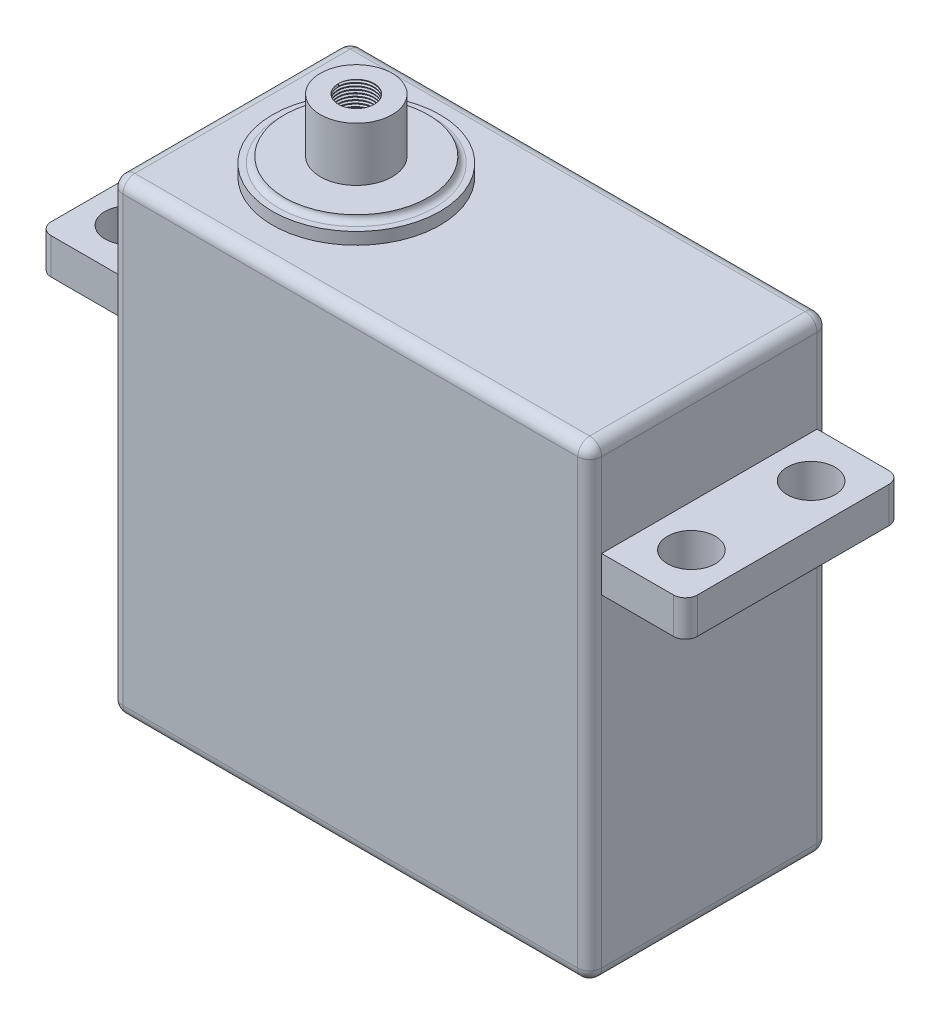
from build123d import *

# Parameters (mm, degrees)
SKETCH_1_W          = 40
SKETCH_1_H          = 39
EXTRUDE_1_DEPTH     = 20
FILLET_1_R          = 1
SKETCH_2_W          = 18
SKETCH_2_H          = 3
EXTRUDE_2_DEPTH     = 7
SKETCH_3_W          = 18
SKETCH_3_H          = 3
EXTRUDE_3_DEPTH     = 7
FILLET_8_R          = 1
FILLET_9_R          = 1
SKETCH_4_R          = 2
CUT_EXTRUDE_1_DEPTH = 7
SKETCH_5_R          = 2
CUT_EXTRUDE_2_DEPTH = 7
SKETCH_6_R          = 2
CUT_EXTRUDE_3_DEPTH = 7
SKETCH_8_R          = 2
CUT_EXTRUDE_4_DEPTH = 7
SKETCH_9_R          = 3
EXTRUDE_4_DEPTH     = 6
SKETCH_10_R         = 7
EXTRUDE_5_DEPTH     = 1
SKETCH_11_R         = 6
EXTRUDE_6_DEPTH     = 2
FILLET_11_R         = 0.5
SKETCH_12_W         = 12
SKETCH_12_H         = 0.5
CUT_EXTRUDE_6_DEPTH = 19
SKETCH_13_R         = 3
EXTRUDE_7_DEPTH     = 6
SKETCH_14_R         = 1.5
CUT_EXTRUDE_7_DEPTH = 6
THREAD_1_PITCH      = 0.25


with BuildPart() as part:
    # Sketch 1 → 凸台-拉伸1 (new body)
    with BuildSketch(Plane.XY):
        with Locations((1.208791209, 10.42505216)):
            Rectangle(SKETCH_1_W, SKETCH_1_H)
    extrude(amount=EXTRUDE_1_DEPTH)

    # 圆角1
    fillet_1_edges = [part.edges().sort_by_distance(p)[0] for p in [
        (21.208791209, 10.42505216, 20),
        (1.208791209, 29.92505216, 20),
        (-18.791208791, 10.42505216, 20),
        (1.208791209, 29.92505216, 0),
        (21.208791209, 10.42505216, 0),
        (1.208791209, -9.07494784, 0),
        (-18.791208791, 10.42505216, 0),
        (-18.791208791, 29.92505216, 10),
        (21.208791209, 29.92505216, 10),
        (21.208791209, -9.07494784, 10),
        (-18.791208791, -9.07494784, 10),
        (1.208791209, -9.07494784, 20),
    ]]
    fillet(fillet_1_edges, radius=FILLET_1_R)

    # 草图2 → 凸台-拉伸2 (add)
    with BuildSketch(Plane.ZY.offset(18.791208791)):
        with Locations((10, 20.42505216)):
            Rectangle(SKETCH_2_W, SKETCH_2_H)
    extrude(amount=EXTRUDE_2_DEPTH)

    # 草图3 → 凸台-拉伸3 (add)
    with BuildSketch(Plane(origin=(21.208791209, 0, 0), x_dir=(0, 0, -1), z_dir=(1, 0, 0))):
        with Locations((-10, 20.42505216)):
            Rectangle(SKETCH_3_W, SKETCH_3_H)
    extrude(amount=EXTRUDE_3_DEPTH)

    # 圆角8
    fillet_8_edges = [part.edges().sort_by_distance(p)[0] for p in [
        (28.208791209, 20.42505216, 1),
    ]]
    fillet(fillet_8_edges, radius=FILLET_8_R)

    # 圆角9
    fillet_9_edges = [part.edges().sort_by_distance(p)[0] for p in [
        (-25.791208791, 20.42505216, 19),
        (-25.791208791, 20.42505216, 1),
        (28.208791209, 20.42505216, 19),
    ]]
    fillet(fillet_9_edges, radius=FILLET_9_R)

    # 草图4 → 切除-拉伸1 (cut)
    with BuildSketch(Plane(origin=(0, 21.92505216, 0), x_dir=(1, 0, 0), z_dir=(0, 1, 0))):
        with Locations(Location((-22.291208791, -5, 0), (0, 0, 180))):
            Circle(SKETCH_4_R)
    extrude(amount=-CUT_EXTRUDE_1_DEPTH, mode=Mode.SUBTRACT)

    # 草图5 → 切除-拉伸2 (cut)
    with BuildSketch(Plane(origin=(0, 21.92505216, 0), x_dir=(1, 0, 0), z_dir=(0, 1, 0))):
        with Locations(Location((-22.291208791, -15, 0), (0, 0, 180))):
            Circle(SKETCH_5_R)
    extrude(amount=-CUT_EXTRUDE_2_DEPTH, mode=Mode.SUBTRACT)

    # 草图6 → 切除-拉伸3 (cut)
    with BuildSketch(Plane(origin=(0, 21.92505216, 0), x_dir=(1, 0, 0), z_dir=(0, 1, 0))):
        with Locations(Location((24.708791209, -5, 0), (0, 0, 180))):
            Circle(SKETCH_6_R)
    extrude(amount=-CUT_EXTRUDE_3_DEPTH, mode=Mode.SUBTRACT)

    # 草图8 → 切除-拉伸4 (cut)
    with BuildSketch(Plane(origin=(0, 21.92505216, 0), x_dir=(1, 0, 0), z_dir=(0, 1, 0))):
        with Locations(Location((24.708791209, -15, 0), (0, 0, 180))):
            Circle(SKETCH_8_R)
    extrude(amount=-CUT_EXTRUDE_4_DEPTH, mode=Mode.SUBTRACT)

    # 草图9 → 凸台-拉伸4 (add)
    with BuildSketch(Plane(origin=(0, 29.92505216, 0), x_dir=(1, 0, 0), z_dir=(0, 1, 0))):
        with Locations(Location((-8.291208791, -10, 0), (0, 0, 90))):
            Circle(SKETCH_9_R)
    extrude(amount=EXTRUDE_4_DEPTH)

    # 草图10 → 凸台-拉伸5 (add)
    with BuildSketch(Plane(origin=(0, 29.92505216, 0), x_dir=(1, 0, 0), z_dir=(0, 1, 0))):
        with Locations(Location((-8.291208791, -10, 0), (0, 0, 90))):
            Circle(SKETCH_10_R)
    extrude(amount=EXTRUDE_5_DEPTH)

    # 草图11 → 凸台-拉伸6 (add)
    with BuildSketch(Plane(origin=(0, 29.92505216, 0), x_dir=(1, 0, 0), z_dir=(0, 1, 0))):
        with Locations(Location((-8.291208791, -10, 0), (0, 0, 270))):
            Circle(SKETCH_11_R)
    extrude(amount=EXTRUDE_6_DEPTH)

    # 圆角11
    fillet_11_edges = [part.edges().sort_by_distance(p)[0] for p in [
        (-8.291208791, 30.92505216, 4),
        (-8.291208791, 31.92505216, 4),
    ]]
    fillet(fillet_11_edges, radius=FILLET_11_R - 0.0001)  # a hair under: the kernel refuses the full size

    # 草图12 → 切除-拉伸6 (cut)
    with BuildSketch(Plane.XY.offset(20)):
        with Locations((-8.291208791, 31.67505216)):
            Rectangle(SKETCH_12_W, SKETCH_12_H)
    extrude(amount=-CUT_EXTRUDE_6_DEPTH, mode=Mode.SUBTRACT)


with BuildPart() as cut_extrude_6_piece_1:
    # of the separate pieces the step leaves, piece 1, a body of its own (cut_extrude_6_pieces)
    add(part.part.solids().sort_by_distance((-8.291208791, 30.92505216, 16.4999))[0])



with BuildPart() as cut_extrude_6_piece_2:
    # of the separate pieces the step leaves, piece 2, a body of its own (cut_extrude_6_pieces)
    add(part.part.solids().sort_by_distance((-8.291208791, 31.92505216, 7))[0])


with BuildPart() as cut_extrude_6_piece_1_1:
    add(cut_extrude_6_piece_1.part)

    add(cut_extrude_6_piece_2.part)  # 凸台-拉伸7 merges 切除-拉伸6 piece 2
    # 草图13 → 凸台-拉伸7 (add)
    with BuildSketch(Plane(origin=(0, 35.92505216, 0), x_dir=(1, 0, 0), z_dir=(0, 1, 0))):
        with Locations(Location((-8.291208791, -10, 0), (0, 0, 270))):
            Circle(SKETCH_13_R)
    extrude(amount=-EXTRUDE_7_DEPTH)

    # 草图14 → 切除-拉伸7 (cut)
    with BuildSketch(Plane(origin=(0, 35.92505216, 0), x_dir=(1, 0, 0), z_dir=(0, 1, 0))):
        with Locations(Location((-8.291208791, -10, 0), (0, 0, 270))):
            Circle(SKETCH_14_R)
    extrude(amount=-CUT_EXTRUDE_7_DEPTH, mode=Mode.SUBTRACT)

    # 螺纹线1: the profile of Sketch 1 2 profile screwed along a right-hand helix of 24 turns, 6 arcs to a turn; built about Z, then put on its axis
    thread_1_z = Axis((0, 0, 0), (0, 0, 1))
    thread_1_corners = [(1.4997, 0, -0.000173205), (1.635316469, 0, 0.078124999), (1.635316469, 0, 0.109374999), (1.4997, 0, 0.187673204)]
    with BuildLine(mode=Mode.PRIVATE) as thread_1_profile:
        Line(thread_1_corners[0], thread_1_corners[1])
        Line(thread_1_corners[1], thread_1_corners[2])
        Line(thread_1_corners[2], thread_1_corners[3])
        Line(thread_1_corners[3], thread_1_corners[0])
    thread_1_cap = Face(thread_1_profile.wire())
    thread_1_turn_angles = [0, 30, 60, 90, 120, 150, 180, 210, 240, 270, 300, 330, 360]
    thread_1_turn_weights = [1, 0.8660254037844387, 1, 0.8660254037844387, 1, 0.8660254037844387, 1, 0.8660254037844387, 1, 0.8660254037844387, 1, 0.8660254037844387, 1]
    thread_1_turn_rails = [Edge.make_bspline([Vector(p[0], p[1], 0).rotate(thread_1_z, thread_1_turn_angles[k]) / thread_1_turn_weights[k] + Vector(0, 0, p[2] + THREAD_1_PITCH * thread_1_turn_angles[k] / 360) for k in range(13)], [0, 0, 0, 1, 1, 2, 2, 3, 3, 4, 4, 5, 5, 6, 6, 6], 2, thread_1_turn_weights) for p in thread_1_corners]
    thread_1_turn_sides = [Face.make_surface_from_curves(thread_1_turn_rails[p[0]], thread_1_turn_rails[p[1]]) for p in [(0, 1), (1, 2), (2, 3), (3, 0)]]
    thread_1 = Plane(origin=(-8.291208791, 35.92505216, 10), x_dir=(-1, 0, 0), z_dir=(0, -1, 0)) * Solid(Shell([*[p.moved(Location((0, 0, THREAD_1_PITCH * i))) for i in range(24) for p in thread_1_turn_sides], thread_1_cap, thread_1_cap.rotate(thread_1_z, 8640).moved(Location((0, 0, THREAD_1_PITCH * 8640 / 360)))]))
    add(thread_1, mode=Mode.SUBTRACT)


solid = cut_extrude_6_piece_1_1.part
